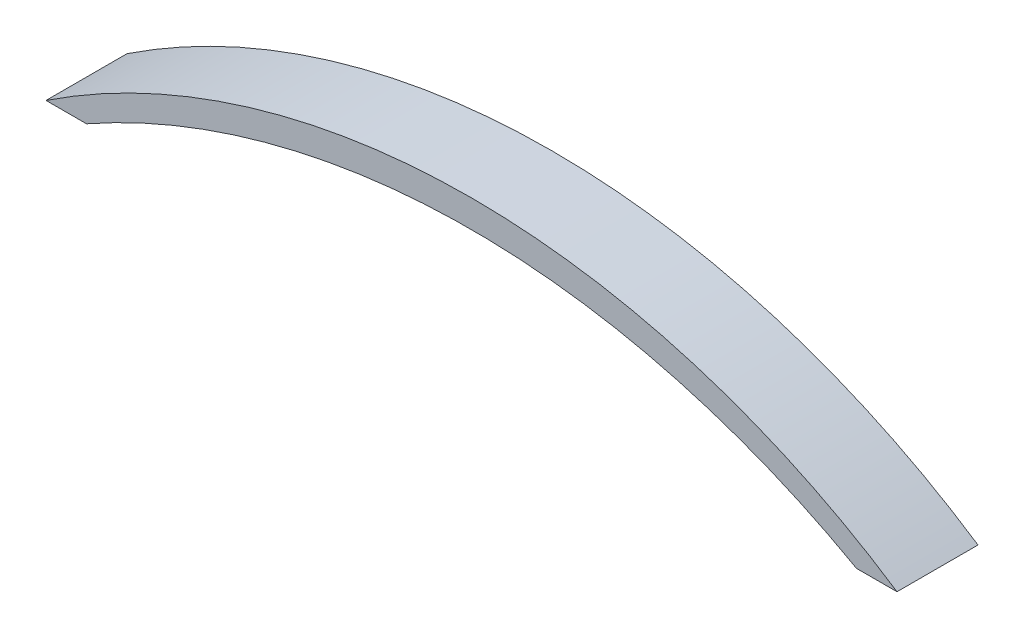
from build123d import *

# Parameters (mm, degrees)
BOSS_EXTRUDE1_DEPTH = 10
SCALE1_SCALE        = 0.5


with BuildPart() as part:
    # Sketch1 → Boss-Extrude1 (new body)
    with BuildSketch(Plane.XY):
        with BuildLine():
            Line((0, 0), (5, 0))
            ThreePointArc((5, 0), (52.528561354, 12.453541306), (100.057122708, 0))
            Line((100.057122708, 0), (105.057122708, 0))
            ThreePointArc((105.057122708, 0), (52.528561354, 15.847728612), (0, 0))
        make_face()
    extrude(amount=BOSS_EXTRUDE1_DEPTH)


with BuildPart() as part_1:
    # Scale1: scaled about (52.528561354, 9.724546383, 5)
    add(part.part.scale(SCALE1_SCALE).moved(Location((26.264280677, 4.862273191, 2.5))))


solid = part_1.part
